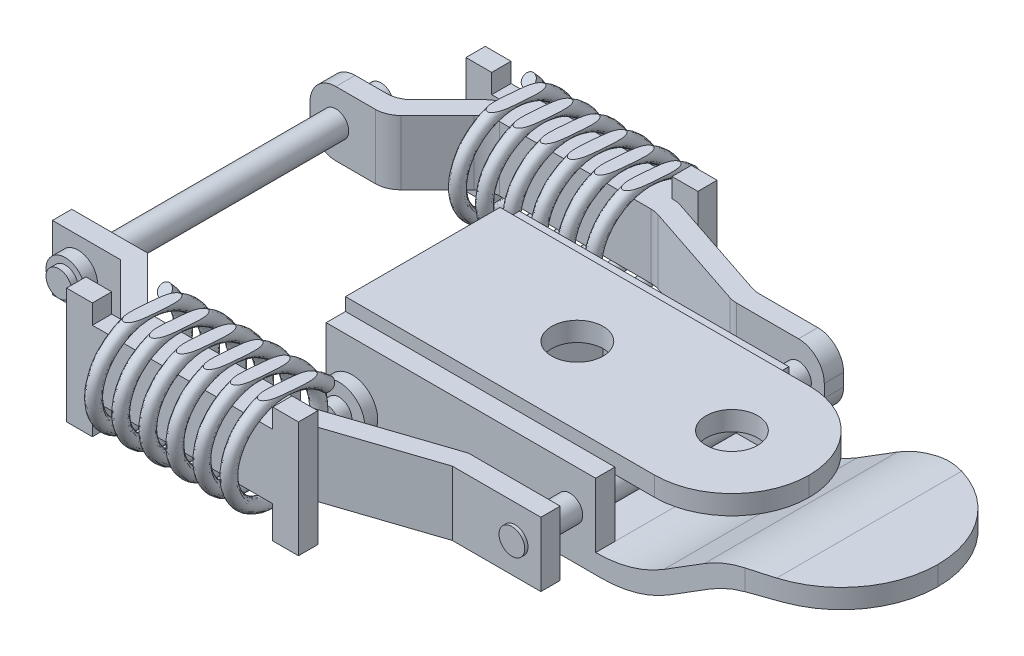
from build123d import *
from build123d.topology import SkipClean

# Parameters (mm, degrees)
EXTRUDE_1_DEPTH       = 7.5
FILLET_1_R            = 10
FILLET_2_R            = 7.5
SKETCH_2_W            = 20.916940566
SKETCH_2_H            = 1.5
EXTRUDE_2_DEPTH       = 5
SKETCH_7_W            = 12
SKETCH_7_H            = 6
EXTRUDE_3_DEPTH       = 8
SKETCH_4_W            = 4
SKETCH_4_H            = 1.5
CUT_EXTRUDE_1_DEPTH   = 4
SKETCH_5_R            = 1
CUT_EXTRUDE_2_DEPTH   = 21.5
EXTRUDE_START         = 1.5
SKETCH_10_R           = 1.95
SKETCH_10_R_2         = 1
EXTRUDE_8_DEPTH       = 1.5
SKETCH_11_R           = 1.95
SKETCH_11_R_2         = 1
EXTRUDE_9_DEPTH       = 1.5
SKETCH_13_W           = 12
SKETCH_13_H           = 1.5
EXTRUDE_11_DEPTH      = 22
FILLET_4_R            = 6
SKETCH_14_R           = 2
CUT_EXTRUDE_7_DEPTH   = 2
CUT_EXTRUDE_START     = -22
SKETCH_15_R           = 1
CUT_EXTRUDE_8_DEPTH   = 22
SKETCH_16_R           = 2
EXTRUDE_12_DEPTH      = 1
EXTRUDE_13_DEPTH      = 1
EXTRUDE_13_DEPTH_BACK = 18
SKETCH_17_R           = 1
SKETCH_18_R           = 1
CUT_EXTRUDE_9_DEPTH   = 18
SKETCH_19_R           = 1
EXTRUDE_14_DEPTH      = 12
EXTRUDE_15_DEPTH      = 2.5
FILLET_5_R            = 2
FILLET_6_R            = 2
FILLET_7_R            = 2
SWEEP_1_PITCH         = 2.1
SWEEP_1_HEIGHT        = 12.6
SWEEP_1_RADIUS        = 4
SWEEP_1_START_ANGLE   = -45
SWEEP_1_PROFILE_R     = 0.5
SKETCH_29_R           = 1
CUT_EXTRUDE_10_DEPTH  = 5
SKETCH_30_R           = 1.5
SKETCH_30_R_2         = 1
EXTRUDE_16_DEPTH      = 1
EXTRUDE_17_DEPTH      = 1
EXTRUDE_17_DEPTH_BACK = 24
SKETCH_31_R           = 1
SKETCH_32_W           = 1.885906509
SKETCH_32_H           = 5
SKETCH_32_W_2         = 12.612719305
SKETCH_32_W_3         = 2
SKETCH_32_H_2         = 2.5
EXTRUDE_18_DEPTH      = 1.5
SWEEP_2_PITCH         = 2.1
SWEEP_2_HEIGHT        = 12.6
SWEEP_2_RADIUS        = 4
SWEEP_2_START_ANGLE   = -45
SWEEP_2_PROFILE_R     = 0.5
SKETCH_45_W           = 95.388975682
SKETCH_45_H           = 44.907694632
CUT_EXTRUDE_11_DEPTH  = 10


with BuildPart() as part:
    # 草图1 → 凸台-拉伸1 (new, symmetric)
    with BuildSketch(Plane.XY):
        Polygon((0, -0.75), (24.21509717, -0.75), (32.21509717, 4.25), (40, 4.25), (40, 5.75), (31.78490283, 5.75), (23.78490283, 0.75), (0, 0.75), align=None)
    extrude(amount=EXTRUDE_1_DEPTH, both=True)

    # 圆角1
    fillet_1_edges = [part.edges().sort_by_distance(p)[0] for p in [
        (23.78490283, 0.75, 0),
        (31.78490283, 5.75, 0),
        (32.21509717, 4.25, 0),
        (24.21509717, -0.75, 0),
    ]]
    fillet(fillet_1_edges, radius=FILLET_1_R)

    # 圆角2
    fillet_2_edges = [part.edges().sort_by_distance(p)[0] for p in [
        (40, 5, -7.5),
        (40, 5, 7.5),
    ]]
    fillet(fillet_2_edges, radius=FILLET_2_R - 0.0001)  # a hair under: the kernel refuses the full size

    # 草图2 → 凸台-拉伸2 (add)
    with BuildSketch(Plane(origin=(0, 0.75, 0), x_dir=(1, 0, 0), z_dir=(0, 1, 0))):
        with Locations((10.458470283, 6.75)):
            Rectangle(SKETCH_2_W, SKETCH_2_H)
        with Locations((10.458470283, -6.75)):
            Rectangle(SKETCH_2_W, SKETCH_2_H)
    extrude(amount=EXTRUDE_2_DEPTH)

    # 草图4 → 切除-拉伸1 (cut)
    with BuildSketch(Plane.XZ.offset(0.75)):
        with Locations((2, 5.25)):
            Rectangle(SKETCH_4_W, SKETCH_4_H)
        with Locations((2, -5.25)):
            Rectangle(SKETCH_4_W, SKETCH_4_H)
    extrude(amount=-CUT_EXTRUDE_1_DEPTH, mode=Mode.SUBTRACT)

    # 草图5 → 切除-拉伸2 (cut)
    with BuildSketch(Plane(origin=(0, 0, -7.5), x_dir=(-1, 0, 0), z_dir=(0, 0, -1))):
        with Locations(Location((-2, 1.25, 0), (0, 0, 180))):
            Circle(SKETCH_5_R)
    extrude(amount=-CUT_EXTRUDE_2_DEPTH, mode=Mode.SUBTRACT)

    # 草图10 → 凸台-拉伸8 (add)
    with BuildSketch(Plane(origin=(0, 0, -4.5), x_dir=(-1, 0, 0), z_dir=(0, 0, -1)).offset(EXTRUDE_START)):
        with Locations(Location((-2, 1.25, 0), (0, 0, 194.857165545))):
            Circle(SKETCH_10_R)
        with Locations(Location((-2, 1.25, 0), (0, 0, 180))):
            Circle(SKETCH_10_R_2, mode=Mode.SUBTRACT)
    extrude(amount=-EXTRUDE_8_DEPTH)

    # 草图11 → 凸台-拉伸9 (add)
    with SkipClean():  # the faces are left unmerged after this step: merging them gives an invalid solid
        with BuildSketch(Plane.XY.offset(4.5)):
            with Locations(Location((2, 1.25, 0), (0, 0, 345.142834455))):
                Circle(SKETCH_11_R)
            with Locations(Location((2, 1.25, 0), (0, 0, 180))):
                Circle(SKETCH_11_R_2, mode=Mode.SUBTRACT)
        extrude(amount=EXTRUDE_9_DEPTH)



with BuildPart() as body_2:
    # 草图7 → 凸台-拉伸3 (new body)
    with BuildSketch(Plane.ZY):
        with Locations((0, 3.75)):
            Rectangle(SKETCH_7_W, SKETCH_7_H)
    extrude(amount=-EXTRUDE_3_DEPTH)


with BuildPart() as part_1:
    with SkipClean():  # the faces are left unmerged after this step: merging them gives an invalid solid
        add(part.part)

        add(body_2.part)  # 凸台-拉伸11 merges body 2
        # 草图13 → 凸台-拉伸11 (add)
        with BuildSketch(Plane(origin=(8, 0, 0), x_dir=(0, 0, -1), z_dir=(1, 0, 0))):
            with Locations((0, 6)):
                Rectangle(SKETCH_13_W, SKETCH_13_H)
        extrude(amount=EXTRUDE_11_DEPTH)

    # 圆角4
    fillet_4_edges = [part_1.edges().sort_by_distance(p)[0] for p in [
        (30, 6, 6),
        (30, 6, -6),
    ]]
    fillet(fillet_4_edges, radius=FILLET_4_R - 0.0001)  # a hair under: the kernel refuses the full size

    # 草图14 → 切除-拉伸7 (cut)
    with BuildSketch(Plane(origin=(0, 6.75, 0), x_dir=(1, 0, 0), z_dir=(0, 1, 0))):
        with Locations(Location((24, 0, 0), (0, 0, 270))):
            Circle(SKETCH_14_R)
        with Locations(Location((12, 0, 0), (0, 0, 270))):
            Circle(SKETCH_14_R)
    extrude(amount=-CUT_EXTRUDE_7_DEPTH, mode=Mode.SUBTRACT)

    # 草图15 → 切除-拉伸8 (cut)
    with BuildSketch(Plane.XY.offset(7.5).offset(CUT_EXTRUDE_START)):
        with Locations(Location((2, 1.25, 0), (0, 0, 180))):
            Circle(SKETCH_15_R)
    extrude(amount=CUT_EXTRUDE_8_DEPTH, mode=Mode.SUBTRACT)

    # 草图16 → 凸台-拉伸12 (add)
    with BuildSketch(Plane.XY.offset(7.5)):
        with Locations(Location((2, 1.25, 0), (0, 0, 180))):
            Circle(SKETCH_16_R)
    extrude_12 = extrude(amount=EXTRUDE_12_DEPTH)

    # 草图17 → 凸台-拉伸13 (add, two sides: drawn at the far end of the back side and taken through both)
    with BuildSketch(Plane.XY.offset(8.5).offset(-EXTRUDE_13_DEPTH_BACK)):
        with Locations((2, 1.25)):
            Circle(SKETCH_17_R)
    extrude(amount=EXTRUDE_13_DEPTH + EXTRUDE_13_DEPTH_BACK)

    # 镜向2: 凸台-拉伸12 across plane
    add(extrude_12.mirror(Plane.XY))

    # 草图18 → 切除-拉伸9 (cut)
    with BuildSketch(Plane.XY.offset(7.5)):
        with Locations((18.916940566, 2.75)):
            Circle(SKETCH_18_R)
    extrude(amount=-CUT_EXTRUDE_9_DEPTH, mode=Mode.SUBTRACT)

    # 草图19 → 凸台-拉伸14 (add, symmetric)
    with BuildSketch(Plane.XY):
        with Locations((18.916940566, 2.75)):
            Circle(SKETCH_19_R)
    extrude(amount=EXTRUDE_14_DEPTH, both=True)

    # 草图20 → 凸台-拉伸15 (add, symmetric)
    with BuildSketch(Plane(origin=(0, 2.75, 0), x_dir=(1, 0, 0), z_dir=(0, 1, 0))):
        Polygon((18.916940566, 11.75), (14.038648811, 11.75), (5.038648811, 14.75), (-8.727052939, 14.75), (-12.727052939, 10.75), (-18, 10.75), (-18, 9.25), (-12.105732595, 9.25), (-8.105732595, 13.25), (4.795232321, 13.25), (13.795232321, 10.25), (18.916940566, 10.25), (20.916940566, 10.25), (20.916940566, 11.75), align=None)
    extrude_15 = extrude(amount=EXTRUDE_15_DEPTH, both=True)

    # 圆角5
    fillet_5_edges = [part_1.edges().sort_by_distance(p)[0] for p in [
        (20.916940566, 0.25, -11),
        (20.916940566, 5.25, -11),
    ]]
    fillet(fillet_5_edges, radius=FILLET_5_R)

    # 圆角6
    fillet_6_edges = [part_1.edges().sort_by_distance(p)[0] for p in [
        (14.038648811, 2.75, -11.75),
        (5.038648811, 2.75, -14.75),
        (-8.727052939, 2.75, -14.75),
        (-12.727052939, 2.75, -10.75),
        (-12.105732595, 2.75, -9.25),
        (-8.105732595, 2.75, -13.25),
        (4.795232321, 2.75, -13.25),
        (13.795232321, 2.75, -10.25),
    ]]
    fillet(fillet_6_edges, radius=FILLET_6_R)

    # 圆角7
    fillet_7_edges = [part_1.edges().sort_by_distance(p)[0] for p in [
        (-18, 0.25, -10),
        (-18, 5.25, -10),
    ]]
    fillet(fillet_7_edges, radius=FILLET_7_R)

    # 草图29 → 切除-拉伸10 (cut)
    with BuildSketch(Plane.XY.offset(-9.25)):
        with Locations((-16, 2.75)):
            Circle(SKETCH_29_R)
    extrude(amount=-CUT_EXTRUDE_10_DEPTH, mode=Mode.SUBTRACT)

    # 草图30 → 凸台-拉伸16 (add)
    with BuildSketch(Plane(origin=(0, 0, -10.75), x_dir=(-1, 0, 0), z_dir=(0, 0, -1))):
        with Locations(Location((16, 2.75, 0), (0, 0, 180))):
            Circle(SKETCH_30_R)
        with Locations(Location((16, 2.75, 0), (0, 0, 180))):
            Circle(SKETCH_30_R_2, mode=Mode.SUBTRACT)
    extrude_16 = extrude(amount=EXTRUDE_16_DEPTH)

    # 草图31 → 凸台-拉伸17 (add, two sides: drawn at the far end of the back side and taken through both)
    with BuildSketch(Plane(origin=(0, 0, -11.75), x_dir=(-1, 0, 0), z_dir=(0, 0, -1)).offset(-EXTRUDE_17_DEPTH_BACK)):
        with Locations((16, 2.75)):
            Circle(SKETCH_31_R)
    extrude(amount=EXTRUDE_17_DEPTH + EXTRUDE_17_DEPTH_BACK)

    # 草图32 → 凸台-拉伸18 (add)
    with BuildSketch(Plane(origin=(0, 0, -14.75), x_dir=(-1, 0, 0), z_dir=(0, 0, -1))):
        Polygon((-6.6, 7.75), (-6.6, 5.25), (-4.714093491, 5.25), (-4.6, 5.25), (-4.6, 7.75), align=None)
        with Locations((-5.657046746, 2.75)):
            Rectangle(SKETCH_32_W, SKETCH_32_H)
        with Locations((1.592266162, 2.75)):
            Rectangle(SKETCH_32_W_2, SKETCH_32_H)
        Polygon((9.4, 5.25), (7.898625814, 5.25), (7.898625814, 0.25), (9.4, 0.25), (11.4, 0.25), (11.4, 5.25), align=None)
        with Locations((10.4, 6.5)):
            Rectangle(SKETCH_32_W_3, SKETCH_32_H_2)
        with Locations((10.4, -1)):
            Rectangle(SKETCH_32_W_3, SKETCH_32_H_2)
        Polygon((-4.714093491, 0.25), (-6.6, 0.25), (-6.6, -2.25), (-4.6, -2.25), (-4.6, 0.25), align=None)
    extrude_18 = extrude(amount=EXTRUDE_18_DEPTH)

    # 镜向14: 凸台-拉伸15, 凸台-拉伸16, 凸台-拉伸18 across plane
    add(extrude_15.mirror(Plane.XY))
    add(extrude_16.mirror(Plane.XY))
    add(extrude_18.mirror(Plane.XY))


with BuildPart() as body_2_2:
    # 扫描1: sweep along a helix
    with BuildLine() as sweep_1_path:
        add(Helix(SWEEP_1_PITCH, SWEEP_1_HEIGHT, SWEEP_1_RADIUS, center=(4, 2.75, -14), direction=(-1, 0, 0), lefthand=True, mode=Mode.PRIVATE).rotate(Axis((4, 2.75, -14), (-1, 0, 0)), SWEEP_1_START_ANGLE))
    # 扫描1 profile (on start of the path) → 扫描1 (sweep)
    with BuildSketch(Plane(origin=(4, 5.578427125, -16.828427125), x_dir=(0, 0.7071067811882643, -0.7071067811848307), z_dir=(-0.0832661824928396, 0.7046512409867193, 0.7046512409901409))):
        Circle(SWEEP_1_PROFILE_R)
    sweep(path=sweep_1_path.line, is_frenet=True)


with BuildPart() as body_3:
    # 扫描2: sweep along a helix
    with BuildLine() as sweep_2_path:
        add(Helix(SWEEP_2_PITCH, SWEEP_2_HEIGHT, SWEEP_2_RADIUS, center=(4, 2.75, 14.25), direction=(-1, 0, 0), lefthand=True, mode=Mode.PRIVATE).rotate(Axis((4, 2.75, 14.25), (-1, 0, 0)), SWEEP_2_START_ANGLE))
    # 扫描2 profile (on start of the path) → 扫描2 (sweep)
    with BuildSketch(Plane(origin=(4, 5.578427125, 11.421572875), x_dir=(0, 0.7071067811890389, -0.7071067811840562), z_dir=(-0.0832661824911778, 0.7046512409860456, 0.704651240991011))):
        Circle(SWEEP_2_PROFILE_R)
    sweep(path=sweep_2_path.line, is_frenet=True)


with BuildPart() as cut_extrude_11_tool:
    # 草图45 → 切除-拉伸11 (new body)
    with BuildSketch(Plane(origin=(0, 6.75, 0), x_dir=(1, 0, 0), z_dir=(0, 1, 0))):
        Rectangle(SKETCH_45_W, SKETCH_45_H)
    extrude(amount=CUT_EXTRUDE_11_DEPTH)


with BuildPart() as part_2:
    add(part_1.part)

    # 切除-拉伸11: cut by cut_extrude_11_tool
    add(cut_extrude_11_tool.part, mode=Mode.SUBTRACT)


with BuildPart() as body_2_2_1:
    add(body_2_2.part)

    # 切除-拉伸11: cut by cut_extrude_11_tool
    add(cut_extrude_11_tool.part, mode=Mode.SUBTRACT)


with BuildPart() as body_3_1:
    add(body_3.part)

    # 切除-拉伸11: cut by cut_extrude_11_tool
    add(cut_extrude_11_tool.part, mode=Mode.SUBTRACT)


solid = Compound([part_2.part, body_2_2_1.part, body_3_1.part])
